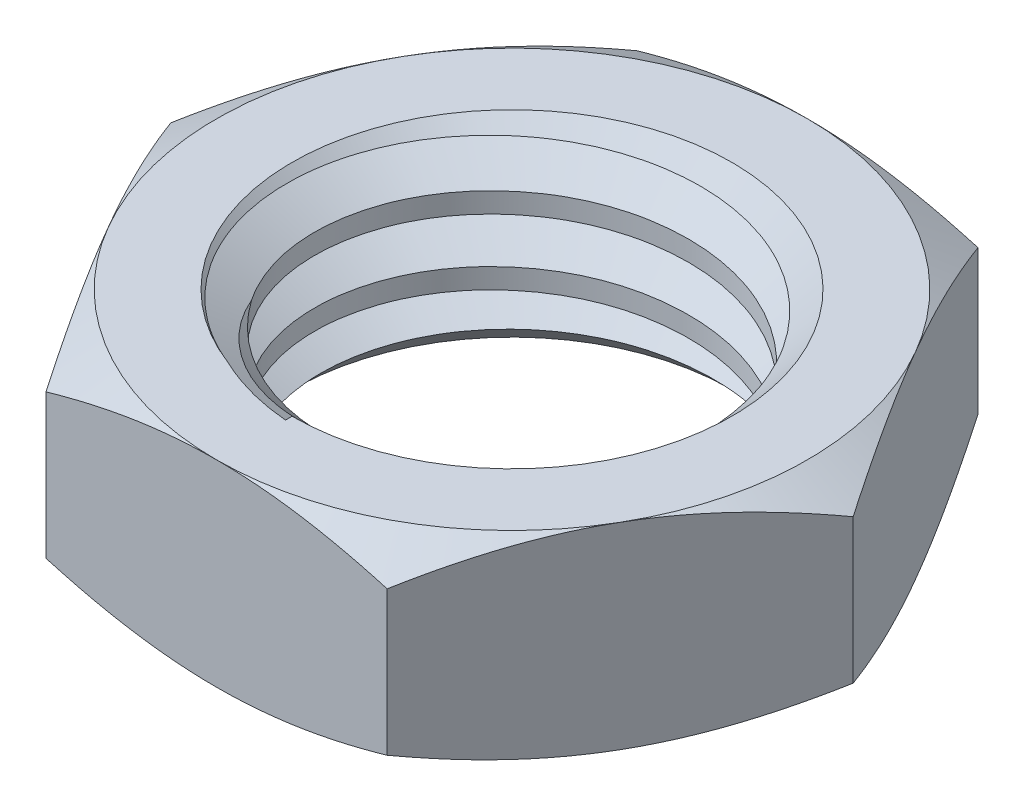
from build123d import *

# Parameters (mm, degrees)
RESSALTO_EXTRUS_O2_DEPTH  = 3
ESBO_O3_OUTSIDE_W         = 56.126
ESBO_O3_OUTSIDE_H         = 53.342
ESBO_O3_OUTSIDE_R         = 9
CORTE_EXTRUS_O1_DEPTH     = 8
CORTE_EXTRUS_O1_DRAFT     = -60
ESPELHAR1_COPY_1_SKETCH_W = 56.126
ESPELHAR1_COPY_1_SKETCH_H = 53.342
ESPELHAR1_COPY_1_SKETCH_R = 9
ESPELHAR1_COPY_1_DEPTH    = 8
ESPELHAR1_COPY_1_DRAFT    = -60
ESBO_O4_R                 = 5.7
CORTE_EXTRUS_O2_DEPTH     = 10
CHANFRO2_SIZE             = 1
VARREDURA_DE_CORTE1_PITCH = 2


with BuildPart() as part:
    # Esboço2 → Ressalto-extrusão2 (new, symmetric)
    with BuildSketch(Plane(origin=(0, 0, 0), x_dir=(1, 0, 0), z_dir=(0, 1, 0))):
        Polygon((10.392304845, 0), (5.196152423, 9), (-5.196152423, 9), (-10.392304845, 0), (-5.196152423, -9), (5.196152423, -9), align=None)
    extrude(amount=RESSALTO_EXTRUS_O2_DEPTH, both=True)


with BuildPart() as corte_extrus_o1_tool:
    # Esboço3 outside → Corte-extrusão1 (with draft: the straight prism first)
    with BuildSketch(Plane(origin=(0, 3, 0), x_dir=(1, 0, 0), z_dir=(0, 1, 0))):
        Rectangle(ESBO_O3_OUTSIDE_W, ESBO_O3_OUTSIDE_H)
        Circle(ESBO_O3_OUTSIDE_R, mode=Mode.SUBTRACT)
    extrude(amount=-CORTE_EXTRUS_O1_DEPTH)
    # Corte-extrusão1: the draft: its side faces are tilted about the plane it starts from
    corte_extrus_o1_sides = [corte_extrus_o1_tool.faces().sort_by_distance(p)[0] for p in [
        (0, -1, 26.671),
        (28.063, -1, 0),
        (0, -1, -26.671),
        (-28.063, -1, 0),
        (-9, -1, 0),
    ]]
    draft(corte_extrus_o1_sides, Plane(origin=(0, 3, 0), x_dir=(1, 0, 0), z_dir=(0, 1, 0)), CORTE_EXTRUS_O1_DRAFT)


with BuildPart() as part_1:
    add(part.part)

    # Corte-extrusão1: cut by corte_extrus_o1_tool
    add(corte_extrus_o1_tool.part, mode=Mode.SUBTRACT)


with BuildPart() as espelhar1_copy_1_tool:
    # Espelhar1 copy 1 sketch → Espelhar1 copy 1 (with draft: the straight prism first)
    with BuildSketch(Plane.XZ.offset(3)):
        Rectangle(ESPELHAR1_COPY_1_SKETCH_W, ESPELHAR1_COPY_1_SKETCH_H)
        Circle(ESPELHAR1_COPY_1_SKETCH_R, mode=Mode.SUBTRACT)
    extrude(amount=-ESPELHAR1_COPY_1_DEPTH)
    # Espelhar1 copy 1: the draft: its side faces are tilted about the plane it starts from
    espelhar1_copy_1_sides = [espelhar1_copy_1_tool.faces().sort_by_distance(p)[0] for p in [
        (0, 1, 26.671),
        (28.063, 1, 0),
        (0, 1, -26.671),
        (-28.063, 1, 0),
        (-9, 1, 0),
    ]]
    draft(espelhar1_copy_1_sides, Plane.XZ.offset(3), ESPELHAR1_COPY_1_DRAFT)


with BuildPart() as part_2:
    add(part_1.part)

    # Espelhar1 copy 1: cut by espelhar1_copy_1_tool
    add(espelhar1_copy_1_tool.part, mode=Mode.SUBTRACT)

    # Esboço4 → Corte-extrusão2 (cut)
    with BuildSketch(Plane(origin=(0, 3, 0), x_dir=(1, 0, 0), z_dir=(0, 1, 0))):
        with Locations(Location((0, 0, 0), (0, 0, 270))):
            Circle(ESBO_O4_R)
    extrude(amount=-CORTE_EXTRUS_O2_DEPTH, mode=Mode.SUBTRACT)

    # Chanfro2
    chanfro2_edges = [part_2.edges().sort_by_distance(p)[0] for p in [
        (0, -3, -5.7),
        (0, 3, -5.7),
    ]]
    chamfer(chanfro2_edges, length=CHANFRO2_SIZE)

    # Varredura de corte1: the profile of Esboço6 screwed along a right-hand helix of 3 turns, 10 arcs to a turn; built about Z, then put on its axis
    varredura_de_corte1_z = Axis((0, 0, 0), (0, 0, 1))
    varredura_de_corte1_corners = [(6.9, 0, 0), (5.1, 0, 1.039230485), (5.1, 0, -1.039230485)]
    with BuildLine(mode=Mode.PRIVATE) as varredura_de_corte1_profile:
        Line(varredura_de_corte1_corners[0], varredura_de_corte1_corners[1])
        Line(varredura_de_corte1_corners[1], varredura_de_corte1_corners[2])
        Line(varredura_de_corte1_corners[2], varredura_de_corte1_corners[0])
    varredura_de_corte1_cap = Face(varredura_de_corte1_profile.wire())
    varredura_de_corte1_turn_angles = [0, 18, 36, 54, 72, 90, 108, 126, 144, 162, 180, 198, 216, 234, 252, 270, 288, 306, 324, 342, 360]
    varredura_de_corte1_turn_weights = [1, 0.9510565162951535, 1, 0.9510565162951535, 1, 0.9510565162951535, 1, 0.9510565162951535, 1, 0.9510565162951535, 1, 0.9510565162951535, 1, 0.9510565162951535, 1, 0.9510565162951535, 1, 0.9510565162951535, 1, 0.9510565162951535, 1]
    varredura_de_corte1_turn_rails = [Edge.make_bspline([Vector(p[0], p[1], 0).rotate(varredura_de_corte1_z, varredura_de_corte1_turn_angles[k]) / varredura_de_corte1_turn_weights[k] + Vector(0, 0, p[2] + VARREDURA_DE_CORTE1_PITCH * varredura_de_corte1_turn_angles[k] / 360) for k in range(21)], [0, 0, 0, 1, 1, 2, 2, 3, 3, 4, 4, 5, 5, 6, 6, 7, 7, 8, 8, 9, 9, 10, 10, 10], 2, varredura_de_corte1_turn_weights) for p in varredura_de_corte1_corners]
    varredura_de_corte1_turn_sides = [Face.make_surface_from_curves(varredura_de_corte1_turn_rails[p[0]], varredura_de_corte1_turn_rails[p[1]]) for p in [(0, 1), (1, 2), (2, 0)]]
    varredura_de_corte1 = Plane(origin=(0, 3, 0), x_dir=(0, 0, 1), z_dir=(0, -1, 0)) * Solid(Shell([*[p.moved(Location((0, 0, VARREDURA_DE_CORTE1_PITCH * i))) for i in range(3) for p in varredura_de_corte1_turn_sides], varredura_de_corte1_cap, varredura_de_corte1_cap.rotate(varredura_de_corte1_z, 1080).moved(Location((0, 0, VARREDURA_DE_CORTE1_PITCH * 1080 / 360)))]))
    add(varredura_de_corte1, mode=Mode.SUBTRACT)


solid = part_2.part
